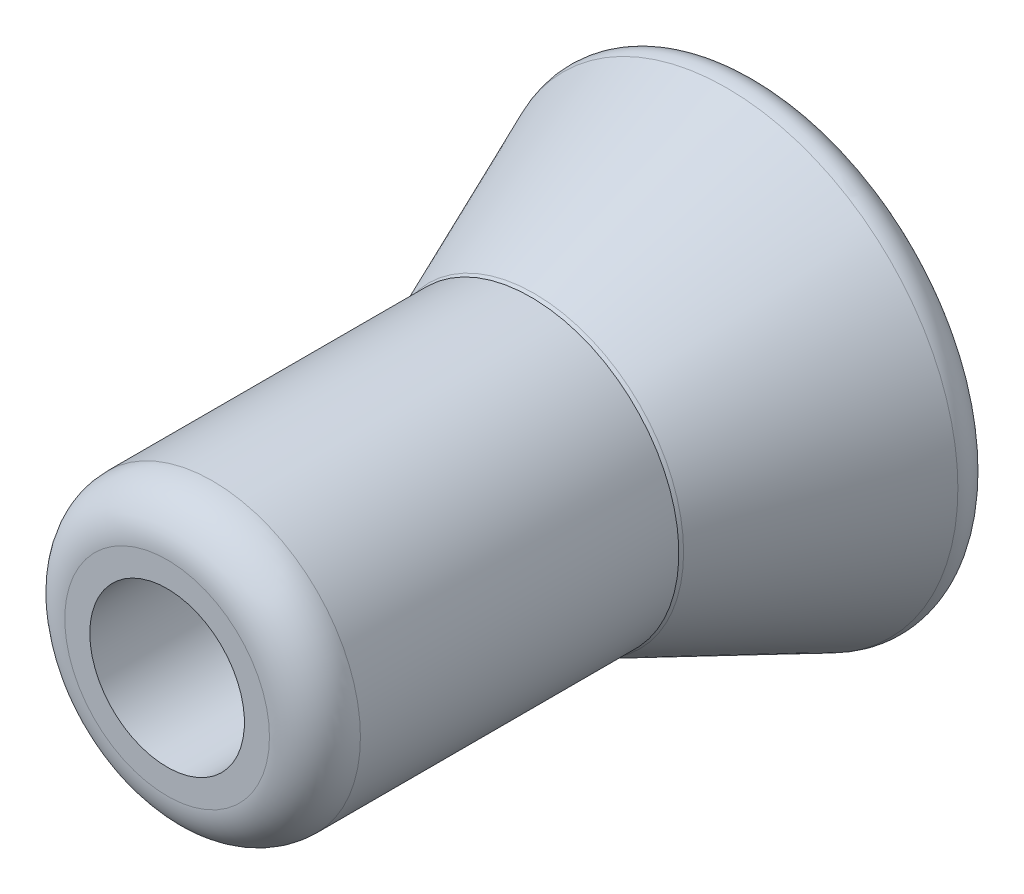
from build123d import *

# Parameters (mm, degrees)
SKETCH_1_R          = 3.25
EXTRUDE_1_DEPTH     = 13
SKETCH_2_R          = 5.375758968
EXTRUDE_2_DEPTH     = 5
EXTRUDE_2_DRAFT     = -23
SKETCH_3_R          = 1.7
CUT_EXTRUDE_1_DEPTH = 16.059799765
FILLET_1_R          = 1
FILLET_2_R          = 0.5
FILLET_3_R          = 1


with BuildPart() as part:
    # 草图1 → 凸台-拉伸1 (new body)
    with BuildSketch(Plane.XY):
        with Locations(Location((0, 0, 0), (0, 0, 180))):
            Circle(SKETCH_1_R)
    extrude(amount=EXTRUDE_1_DEPTH)


with BuildPart() as extrude_2_tool:
    # 草图2 → 凸台-拉伸2 (with draft: the straight prism first)
    with BuildSketch(Plane(origin=(0, 0, 0), x_dir=(-1, 0, 0), z_dir=(0, 0, -1))):
        Circle(SKETCH_2_R)
    extrude(amount=-EXTRUDE_2_DEPTH)
    # 凸台-拉伸2: the draft: its side faces are tilted about the plane it starts from
    extrude_2_sides = [extrude_2_tool.faces().sort_by_distance(p)[0] for p in [
        (5.375758968, 0, 2.5),
    ]]
    draft(extrude_2_sides, Plane(origin=(0, 0, 0), x_dir=(-1, 0, 0), z_dir=(0, 0, -1)), EXTRUDE_2_DRAFT)


with BuildPart() as part_1:
    add(part.part)

    # 凸台-拉伸2: add extrude_2_tool
    add(extrude_2_tool.part)

    # 草图3 → 切除-拉伸1 (cut, through all)
    with BuildSketch(Plane(origin=(0, 0, 0), x_dir=(-1, 0, 0), z_dir=(0, 0, -1))):
        Circle(SKETCH_3_R)
    extrude(amount=-CUT_EXTRUDE_1_DEPTH, mode=Mode.SUBTRACT)

    # 圆角1
    fillet_1_edges = [part_1.edges().sort_by_distance(p)[0] for p in [
        (3.25, 0, 13),
    ]]
    fillet(fillet_1_edges, radius=FILLET_1_R)

    # 圆角2
    fillet_2_edges = [part_1.edges().sort_by_distance(p)[0] for p in [
        (5.375758968, 0, 0),
    ]]
    fillet(fillet_2_edges, radius=FILLET_2_R)

    # 圆角3
    # the kernel refuses this fillet: 1 mm, written as the material it takes off along each edge
    with BuildSketch(Plane(origin=(0, 0, 5), x_dir=(-1, 0, 0), z_dir=(0, -1, 0))) as fillet_3_piece_1:
        with BuildLine():
            CenterArc((2.363183754, 0.46212222), FILLET_3_R, 332.475864529, 4.524135471)
            Line((3.25, 0), (3.253384887, 0))
            Line((3.253384887, 0), (3.283688608, 0.071391091))
        make_face()
    revolve(axis=Axis((0, 0, 5), (0, 0, -1)), mode=Mode.SUBTRACT)


solid = part_1.part
